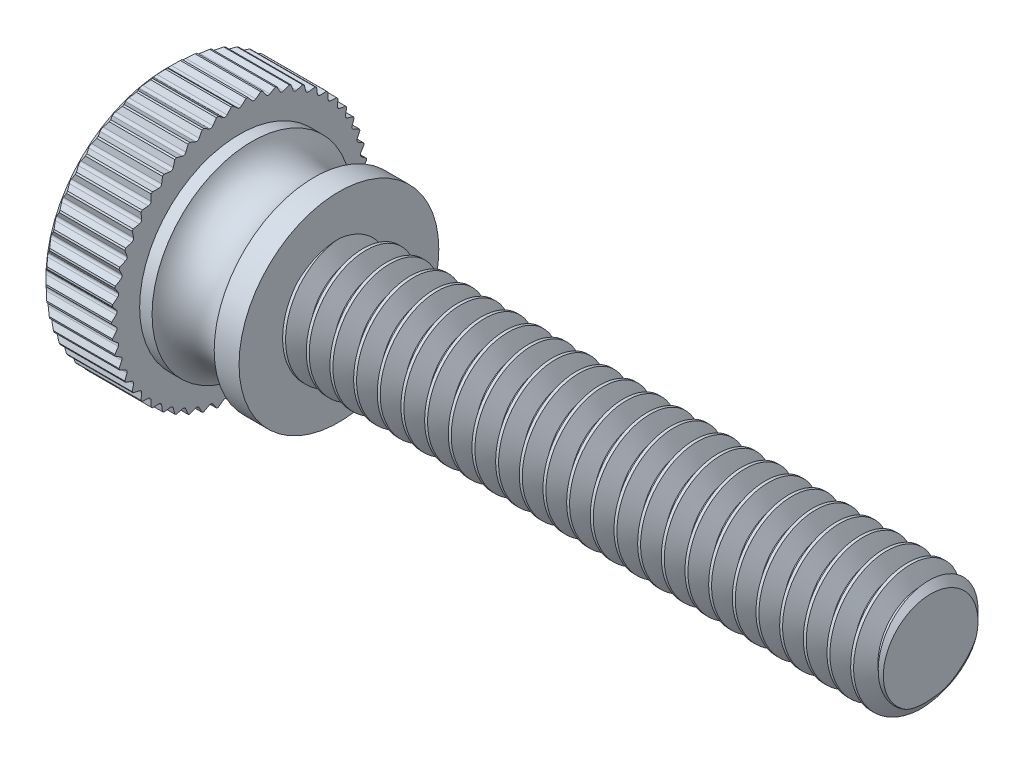
from build123d import *

# Parameters (mm, degrees)
CHAMFER1_SIZE      = 0.635
CHAMFER2_SIZE      = 0.41148
CUT_SWEEP1_PITCH   = 1.27
CUT_SWEEP1_TO      = 31.75
CUT_EXTRUDE1_DEPTH = 9.271
CIRPATTERN1_COUNT  = 54


with BuildPart() as part:
    # Sketch3 → Revolve1 (revolve)
    with BuildSketch(Plane.XY, mode=Mode.PRIVATE) as revolve1_sk:
        with BuildLine():
            Line((-9.271, 0), (-9.271, 6.858))
            Line((-9.271, 6.858), (-5.334, 6.858))
            Line((-5.334, 6.858), (-5.334, 5.3594))
            Line((-5.334, 5.3594), (-4.66725, 5.3594))
            ThreePointArc((-4.66725, 5.3594), (-3.000375, 4.28752), (-1.3335, 5.3594))
            Line((-1.3335, 5.3594), (0, 5.3594))
            Line((0, 5.3594), (0, 3.175))
            Line((0, 3.175), (31.75, 3.175))
            Line((31.75, 3.175), (31.75, 0))
            Line((31.75, 0), (-9.271, 0))
        make_face()
    revolve(revolve1_sk.sketch.rotate(Axis((0, 0, 0), (1, 0, 0)), 90), axis=Axis((0, 0, 0), (1, 0, 0)))

    # Chamfer1
    chamfer1_edges = [part.edges().sort_by_distance(p)[0] for p in [
        (31.75, 0, -3.175),
    ]]
    chamfer(chamfer1_edges, length=CHAMFER1_SIZE)

    # Chamfer2
    chamfer2_edges = [part.edges().sort_by_distance(p)[0] for p in [
        (-9.271, 0, -6.858),
    ]]
    chamfer(chamfer2_edges, length=CHAMFER2_SIZE)


with BuildPart() as body_2:
    # Split1: the piece on the far side of the plane
    add(part.part)
    split(bisect_by=Plane(origin=(0, 0, 0), x_dir=(0, 0, 1), z_dir=(1, 0, 0)), keep=Keep.BOTTOM)


with BuildPart() as part_1:
    add(part.part)

    # Split1
    split(bisect_by=Plane(origin=(0, 0, 0), x_dir=(0, 0, 1), z_dir=(1, 0, 0)), keep=Keep.TOP)

    # Cut-Sweep1: arcs per turn and ends read off the stored shape
    # Cut-Sweep1: the profile of Sketch5 screwed along a right-hand helix through 26 turns, 8 arcs to a turn; built about Z, then put on its axis
    cut_sweep1_z = Axis((0, 0, 0), (0, 0, 1))
    cut_sweep1_corners = [(3.243740766, 0, 0.0396875), (3.243740766, 0, -1.1509375), (2.350110803, 0, -0.635), (2.350110803, 0, -0.47625)]
    with BuildLine(mode=Mode.PRIVATE) as cut_sweep1_profile:
        Line(cut_sweep1_corners[0], cut_sweep1_corners[1])
        Line(cut_sweep1_corners[1], cut_sweep1_corners[2])
        Line(cut_sweep1_corners[2], cut_sweep1_corners[3])
        Line(cut_sweep1_corners[3], cut_sweep1_corners[0])
    cut_sweep1_cap = Face(cut_sweep1_profile.wire())
    cut_sweep1_turn_angles = [0, 22.5, 45, 67.5, 90, 112.5, 135, 157.5, 180, 202.5, 225, 247.5, 270, 292.5, 315, 337.5, 360]
    cut_sweep1_turn_weights = [1, 0.9238795325112867, 1, 0.9238795325112867, 1, 0.9238795325112867, 1, 0.9238795325112867, 1, 0.9238795325112867, 1, 0.9238795325112867, 1, 0.9238795325112867, 1, 0.9238795325112867, 1]
    cut_sweep1_turn_rails = [Edge.make_bspline([Vector(p[0], p[1], 0).rotate(cut_sweep1_z, cut_sweep1_turn_angles[k]) / cut_sweep1_turn_weights[k] + Vector(0, 0, p[2] + CUT_SWEEP1_PITCH * cut_sweep1_turn_angles[k] / 360) for k in range(17)], [0, 0, 0, 1, 1, 2, 2, 3, 3, 4, 4, 5, 5, 6, 6, 7, 7, 8, 8, 8], 2, cut_sweep1_turn_weights) for p in cut_sweep1_corners]
    cut_sweep1_turn_sides = [Face.make_surface_from_curves(cut_sweep1_turn_rails[p[0]], cut_sweep1_turn_rails[p[1]]) for p in [(0, 1), (1, 2), (2, 3), (3, 0)]]
    cut_sweep1 = Plane(origin=(31.75, 0, 0), x_dir=(0, 1, 0), z_dir=(-1, 0, 0)) * split(Solid(Shell([*[p.moved(Location((0, 0, CUT_SWEEP1_PITCH * i))) for i in range(26) for p in cut_sweep1_turn_sides], cut_sweep1_cap, cut_sweep1_cap.rotate(cut_sweep1_z, 9360).moved(Location((0, 0, CUT_SWEEP1_PITCH * 9360 / 360)))])), bisect_by=Plane.XY.offset(CUT_SWEEP1_TO), keep=Keep.BOTTOM, mode=Mode.PRIVATE)
    add(cut_sweep1, mode=Mode.SUBTRACT)

    add(body_2.part)  # Boss-Extrude1 merges body 2
    # Boss-Extrude1 cone 1 section (through the dimple's axis) → Boss-Extrude1 (revolve)
    with BuildSketch(Plane(origin=(0, 0, 0), x_dir=(0, 0, -1), z_dir=(0, 1, 0))):
        Polygon((0, 0), (3.175, 0), (0, 1.833087105), align=None)
    revolve(axis=Axis((0, 0, 0), (-1, 0, 0)))

    # Sketch7 → Cut-Extrude1 (cut)
    with BuildSketch(Plane.ZY.offset(9.271)):
        with BuildLine():
            Line((-0.637405357, 7.112), (0.637405357, 7.112))
            Line((0.637405357, 7.112), (0.10287, 6.623598943))
            ThreePointArc((0.10287, 6.623598943), (0, 6.58368), (-0.10287, 6.623598943))
            Line((-0.10287, 6.623598943), (-0.637405357, 7.112))
        make_face()
    cut_extrude1 = extrude(amount=-CUT_EXTRUDE1_DEPTH, mode=Mode.SUBTRACT)

    # CirPattern1: Cut-Extrude1 ×54 about axis
    cirpattern1_axis = Axis((0, 0, 0), (1, 0, 0))
    for i in range(1, CIRPATTERN1_COUNT):
        add(cut_extrude1.rotate(cirpattern1_axis, i * 360 / CIRPATTERN1_COUNT), mode=Mode.SUBTRACT)


solid = part_1.part
